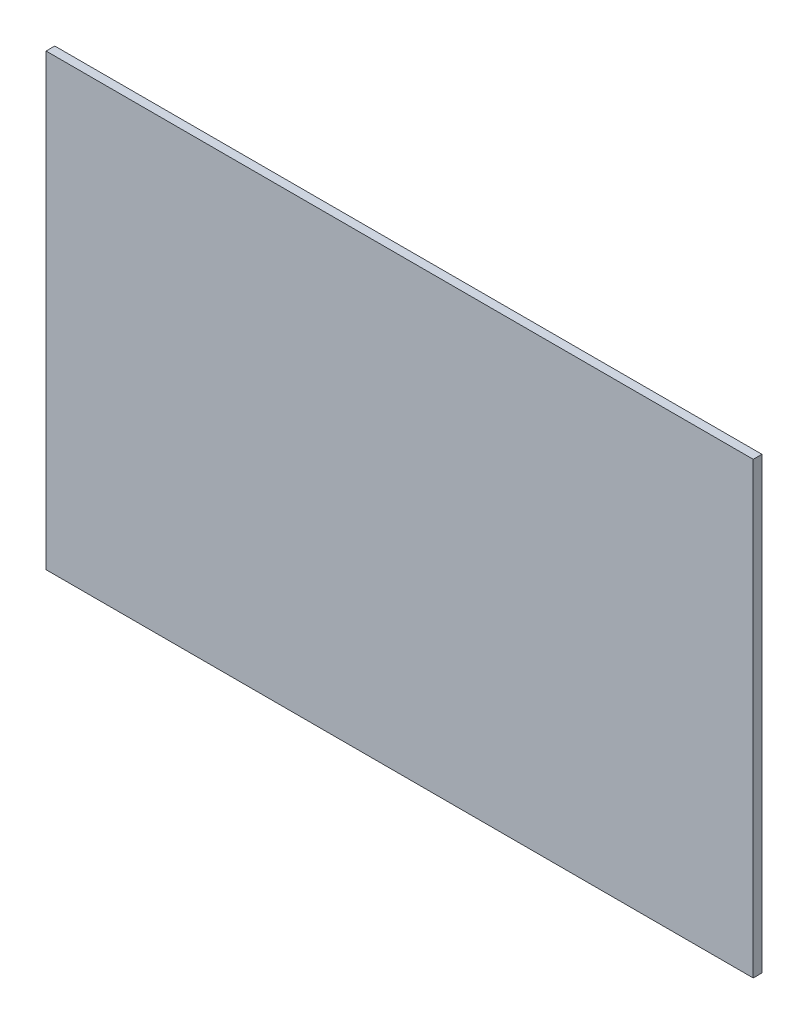
from build123d import *

# Parameters (mm, degrees)
SKETCH1_W           = 2440
SKETCH1_H           = 1550
BOSS_EXTRUDE1_DEPTH = 30


with BuildPart() as part:
    # Sketch1 → Boss-Extrude1 (new body)
    with BuildSketch(Plane.XY):
        with Locations((1220, 775)):
            Rectangle(SKETCH1_W, SKETCH1_H)
    extrude(amount=BOSS_EXTRUDE1_DEPTH)


solid = part.part
